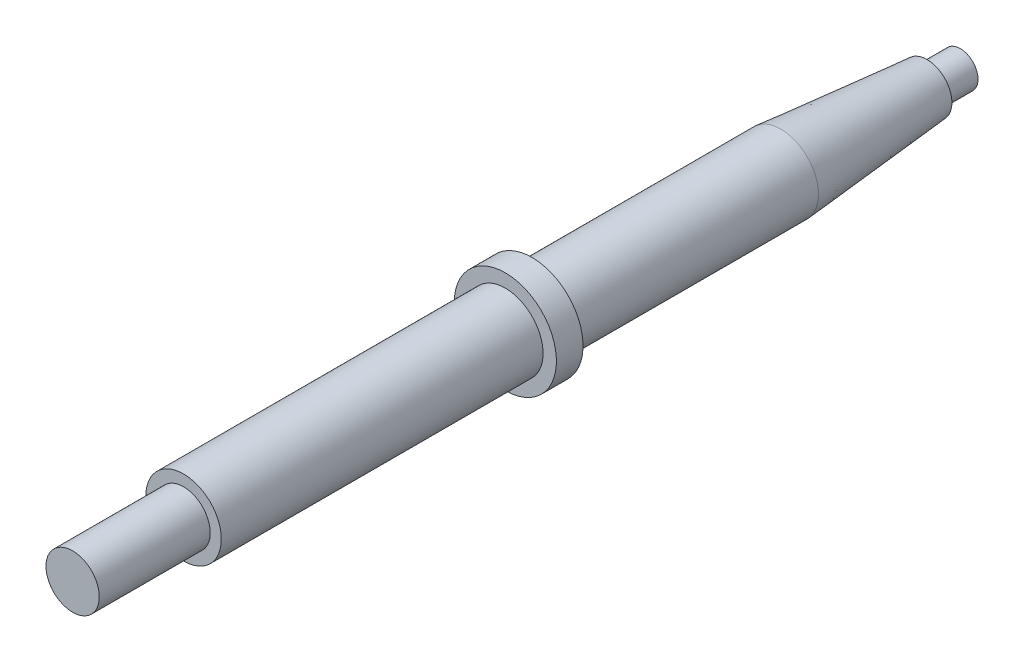
from build123d import *


with BuildPart() as part:
    # Base Sketch → Revolve1 (revolve)
    with BuildSketch(Plane(origin=(0, 0, 0), x_dir=(1, 0, 0), z_dir=(0, 1, 0))):
        Polygon((-11.225361683, 153.992599386), (-12.843485106, 153.992599386), (-12.843485106, 161.492599386), (-16.843485106, 161.492599386), (-16.843485106, -13.507400614), (-16.843485106, -38.507400614), (-10.843485106, -38.507400614), (-10.843485106, -13.507400614), (-8.343485106, -13.507400614), (-8.343485106, 58.992599386), (-5.343485106, 58.992599386), (-5.343485106, 64.992599386), (-8.343485106, 64.992599386), (-8.343485106, 121.052599386), align=None)
    revolve(axis=Axis((-16.843485106, 0, -161.492599386), (0, 0, 1)))


solid = part.part
